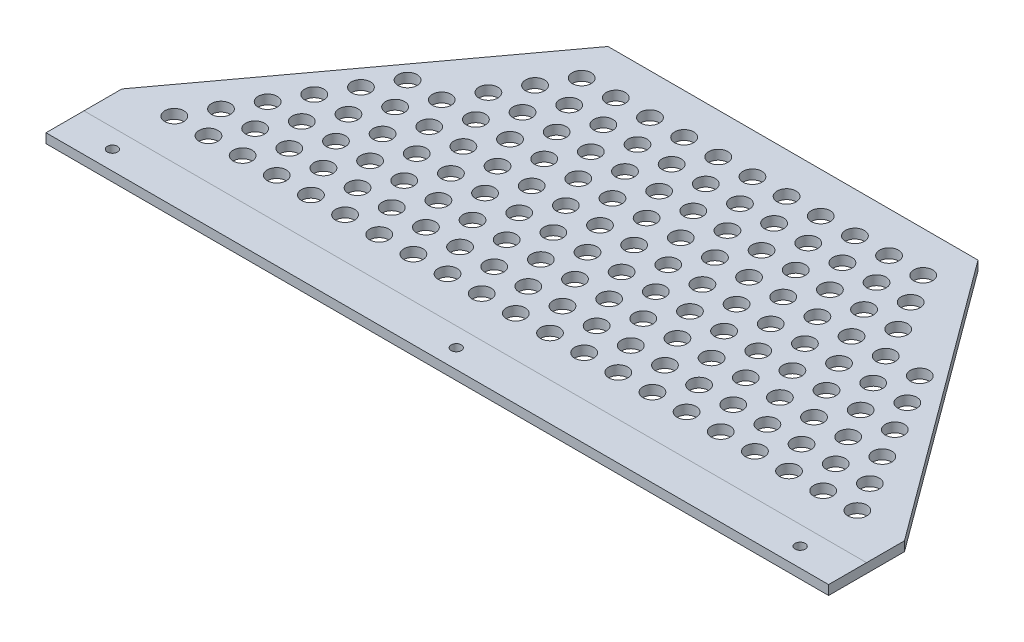
from build123d import *

# Parameters (mm, degrees)
BASE_FLANGE1_DEPTH      = 6.35
SKETCH6_R               = 3.3782
CUT_EXTRUDE1_DEPTH      = 355.055210428
FILL_START              = -6.35
FILL_PATTERN1_OUTLINE_R = 6.35
FILL_PATTERN1_DEPTH     = 6.35


# Read off the part's stored shape, not the designer's step: Fill Pattern1
# Sheet-metal steps are written as plain solids
with BuildPart() as part:
    # Sketch1 → Base-Flange1 (new body)
    with BuildSketch(Plane(origin=(0, 0, 0), x_dir=(1, 0, 0), z_dir=(0, 1, 0))):
        Polygon((-123.825, 0), (123.825, 0), (261.9375, -187.325), (261.9375, -238.125), (-261.9375, -238.125), (-261.9375, -187.325), align=None)
    extrude(amount=-BASE_FLANGE1_DEPTH)

    # Sketch6 → Cut-Extrude1 (cut, through all)
    with BuildSketch(Plane(origin=(0, 0, 0), x_dir=(1, 0, 0), z_dir=(0, 1, 0))):
        with Locations(Location((-230.1875, -225.425, 0), (0, 0, 270))):
            Circle(SKETCH6_R)
        with Locations(Location((0, -225.425, 0), (0, 0, 270))):
            Circle(SKETCH6_R)
        with Locations(Location((230.1875, -225.425, 0), (0, 0, 270))):
            Circle(SKETCH6_R)
    extrude(amount=-CUT_EXTRUDE1_DEPTH, mode=Mode.SUBTRACT)

    # Fill Pattern1 outline → Fill Pattern1 (cut)
    with BuildSketch(Plane(origin=(0, 0, 0), x_dir=(1, 0, 0), z_dir=(0, 1, 0)).offset(FILL_START)):
        with Locations((-228.6, -185.551857922)):
            Circle(FILL_PATTERN1_OUTLINE_R)
        with Locations((68.58, -27.173132078)):
            Circle(FILL_PATTERN1_OUTLINE_R)
        with Locations((45.72, -27.173132078)):
            Circle(FILL_PATTERN1_OUTLINE_R)
        with Locations((22.86, -27.173132078)):
            Circle(FILL_PATTERN1_OUTLINE_R)
        with Locations((0, -27.173132078)):
            Circle(FILL_PATTERN1_OUTLINE_R)
        with Locations((-22.86, -27.173132078)):
            Circle(FILL_PATTERN1_OUTLINE_R)
        with Locations((-45.72, -27.173132078)):
            Circle(FILL_PATTERN1_OUTLINE_R)
        with Locations((-68.58, -27.173132078)):
            Circle(FILL_PATTERN1_OUTLINE_R)
        with Locations((-91.44, -27.173132078)):
            Circle(FILL_PATTERN1_OUTLINE_R)
        with Locations((-11.43, -46.970472808)):
            Circle(FILL_PATTERN1_OUTLINE_R)
        with Locations((11.43, -46.970472808)):
            Circle(FILL_PATTERN1_OUTLINE_R)
        with Locations((34.29, -46.970472808)):
            Circle(FILL_PATTERN1_OUTLINE_R)
        with Locations((57.15, -46.970472808)):
            Circle(FILL_PATTERN1_OUTLINE_R)
        with Locations((-114.3, -27.173132078)):
            Circle(FILL_PATTERN1_OUTLINE_R)
        with Locations((125.73, -46.970472808)):
            Circle(FILL_PATTERN1_OUTLINE_R)
        with Locations((102.87, -46.970472808)):
            Circle(FILL_PATTERN1_OUTLINE_R)
        with Locations((80.01, -46.970472808)):
            Circle(FILL_PATTERN1_OUTLINE_R)
        with Locations((91.44, -27.173132078)):
            Circle(FILL_PATTERN1_OUTLINE_R)
        with Locations((114.3, -27.173132078)):
            Circle(FILL_PATTERN1_OUTLINE_R)
        with Locations((57.15, -165.754517192)):
            Circle(FILL_PATTERN1_OUTLINE_R)
        with Locations((80.01, -165.754517192)):
            Circle(FILL_PATTERN1_OUTLINE_R)
        with Locations((102.87, -165.754517192)):
            Circle(FILL_PATTERN1_OUTLINE_R)
        with Locations((125.73, -165.754517192)):
            Circle(FILL_PATTERN1_OUTLINE_R)
        with Locations((148.59, -165.754517192)):
            Circle(FILL_PATTERN1_OUTLINE_R)
        with Locations((171.45, -165.754517192)):
            Circle(FILL_PATTERN1_OUTLINE_R)
        with Locations((194.31, -165.754517192)):
            Circle(FILL_PATTERN1_OUTLINE_R)
        with Locations((217.17, -165.754517192)):
            Circle(FILL_PATTERN1_OUTLINE_R)
        with Locations((-205.74, -145.957176461)):
            Circle(FILL_PATTERN1_OUTLINE_R)
        with Locations((-182.88, -145.957176461)):
            Circle(FILL_PATTERN1_OUTLINE_R)
        with Locations((-160.02, -145.957176461)):
            Circle(FILL_PATTERN1_OUTLINE_R)
        with Locations((-137.16, -145.957176461)):
            Circle(FILL_PATTERN1_OUTLINE_R)
        with Locations((-114.3, -145.957176461)):
            Circle(FILL_PATTERN1_OUTLINE_R)
        with Locations((-91.44, -145.957176461)):
            Circle(FILL_PATTERN1_OUTLINE_R)
        with Locations((-68.58, -145.957176461)):
            Circle(FILL_PATTERN1_OUTLINE_R)
        with Locations((-45.72, -145.957176461)):
            Circle(FILL_PATTERN1_OUTLINE_R)
        with Locations((-194.31, -126.159835731)):
            Circle(FILL_PATTERN1_OUTLINE_R)
        with Locations((205.74, -145.957176461)):
            Circle(FILL_PATTERN1_OUTLINE_R)
        with Locations((182.88, -145.957176461)):
            Circle(FILL_PATTERN1_OUTLINE_R)
        with Locations((160.02, -145.957176461)):
            Circle(FILL_PATTERN1_OUTLINE_R)
        with Locations((-171.45, -126.159835731)):
            Circle(FILL_PATTERN1_OUTLINE_R)
        with Locations((-148.59, -126.159835731)):
            Circle(FILL_PATTERN1_OUTLINE_R)
        with Locations((-125.73, -126.159835731)):
            Circle(FILL_PATTERN1_OUTLINE_R)
        with Locations((-102.87, -126.159835731)):
            Circle(FILL_PATTERN1_OUTLINE_R)
        with Locations((137.16, -145.957176461)):
            Circle(FILL_PATTERN1_OUTLINE_R)
        with Locations((114.3, -145.957176461)):
            Circle(FILL_PATTERN1_OUTLINE_R)
        with Locations((91.44, -145.957176461)):
            Circle(FILL_PATTERN1_OUTLINE_R)
        with Locations((68.58, -145.957176461)):
            Circle(FILL_PATTERN1_OUTLINE_R)
        with Locations((45.72, -145.957176461)):
            Circle(FILL_PATTERN1_OUTLINE_R)
        with Locations((22.86, -145.957176461)):
            Circle(FILL_PATTERN1_OUTLINE_R)
        with Locations((0, -145.957176461)):
            Circle(FILL_PATTERN1_OUTLINE_R)
        with Locations((-22.86, -145.957176461)):
            Circle(FILL_PATTERN1_OUTLINE_R)
        with Locations((-205.74, -185.551857922)):
            Circle(FILL_PATTERN1_OUTLINE_R)
        with Locations((-182.88, -185.551857922)):
            Circle(FILL_PATTERN1_OUTLINE_R)
        with Locations((-160.02, -185.551857922)):
            Circle(FILL_PATTERN1_OUTLINE_R)
        with Locations((-137.16, -185.551857922)):
            Circle(FILL_PATTERN1_OUTLINE_R)
        with Locations((-114.3, -185.551857922)):
            Circle(FILL_PATTERN1_OUTLINE_R)
        with Locations((-91.44, -185.551857922)):
            Circle(FILL_PATTERN1_OUTLINE_R)
        with Locations((-68.58, -185.551857922)):
            Circle(FILL_PATTERN1_OUTLINE_R)
        with Locations((-45.72, -185.551857922)):
            Circle(FILL_PATTERN1_OUTLINE_R)
        with Locations((-22.86, -185.551857922)):
            Circle(FILL_PATTERN1_OUTLINE_R)
        with Locations((0, -185.551857922)):
            Circle(FILL_PATTERN1_OUTLINE_R)
        with Locations((22.86, -185.551857922)):
            Circle(FILL_PATTERN1_OUTLINE_R)
        with Locations((45.72, -185.551857922)):
            Circle(FILL_PATTERN1_OUTLINE_R)
        with Locations((68.58, -185.551857922)):
            Circle(FILL_PATTERN1_OUTLINE_R)
        with Locations((91.44, -185.551857922)):
            Circle(FILL_PATTERN1_OUTLINE_R)
        with Locations((114.3, -185.551857922)):
            Circle(FILL_PATTERN1_OUTLINE_R)
        with Locations((137.16, -185.551857922)):
            Circle(FILL_PATTERN1_OUTLINE_R)
        with Locations((34.29, -165.754517192)):
            Circle(FILL_PATTERN1_OUTLINE_R)
        with Locations((11.43, -165.754517192)):
            Circle(FILL_PATTERN1_OUTLINE_R)
        with Locations((-11.43, -165.754517192)):
            Circle(FILL_PATTERN1_OUTLINE_R)
        with Locations((-34.29, -165.754517192)):
            Circle(FILL_PATTERN1_OUTLINE_R)
        with Locations((-57.15, -165.754517192)):
            Circle(FILL_PATTERN1_OUTLINE_R)
        with Locations((-80.01, -165.754517192)):
            Circle(FILL_PATTERN1_OUTLINE_R)
        with Locations((-102.87, -165.754517192)):
            Circle(FILL_PATTERN1_OUTLINE_R)
        with Locations((-125.73, -165.754517192)):
            Circle(FILL_PATTERN1_OUTLINE_R)
        with Locations((-148.59, -165.754517192)):
            Circle(FILL_PATTERN1_OUTLINE_R)
        with Locations((-171.45, -165.754517192)):
            Circle(FILL_PATTERN1_OUTLINE_R)
        with Locations((-194.31, -165.754517192)):
            Circle(FILL_PATTERN1_OUTLINE_R)
        with Locations((-217.17, -165.754517192)):
            Circle(FILL_PATTERN1_OUTLINE_R)
        with Locations((228.6, -185.551857922)):
            Circle(FILL_PATTERN1_OUTLINE_R)
        with Locations((205.74, -185.551857922)):
            Circle(FILL_PATTERN1_OUTLINE_R)
        with Locations((182.88, -185.551857922)):
            Circle(FILL_PATTERN1_OUTLINE_R)
        with Locations((160.02, -185.551857922)):
            Circle(FILL_PATTERN1_OUTLINE_R)
        with Locations((57.15, -86.565154269)):
            Circle(FILL_PATTERN1_OUTLINE_R)
        with Locations((80.01, -86.565154269)):
            Circle(FILL_PATTERN1_OUTLINE_R)
        with Locations((102.87, -86.565154269)):
            Circle(FILL_PATTERN1_OUTLINE_R)
        with Locations((125.73, -86.565154269)):
            Circle(FILL_PATTERN1_OUTLINE_R)
        with Locations((148.59, -86.565154269)):
            Circle(FILL_PATTERN1_OUTLINE_R)
        with Locations((171.45, -86.565154269)):
            Circle(FILL_PATTERN1_OUTLINE_R)
        with Locations((-137.16, -66.767813539)):
            Circle(FILL_PATTERN1_OUTLINE_R)
        with Locations((-114.3, -66.767813539)):
            Circle(FILL_PATTERN1_OUTLINE_R)
        with Locations((34.29, -86.565154269)):
            Circle(FILL_PATTERN1_OUTLINE_R)
        with Locations((11.43, -86.565154269)):
            Circle(FILL_PATTERN1_OUTLINE_R)
        with Locations((-11.43, -86.565154269)):
            Circle(FILL_PATTERN1_OUTLINE_R)
        with Locations((-34.29, -86.565154269)):
            Circle(FILL_PATTERN1_OUTLINE_R)
        with Locations((-57.15, -86.565154269)):
            Circle(FILL_PATTERN1_OUTLINE_R)
        with Locations((-80.01, -86.565154269)):
            Circle(FILL_PATTERN1_OUTLINE_R)
        with Locations((-102.87, -86.565154269)):
            Circle(FILL_PATTERN1_OUTLINE_R)
        with Locations((-125.73, -86.565154269)):
            Circle(FILL_PATTERN1_OUTLINE_R)
        with Locations((-125.73, -46.970472808)):
            Circle(FILL_PATTERN1_OUTLINE_R)
        with Locations((137.16, -66.767813539)):
            Circle(FILL_PATTERN1_OUTLINE_R)
        with Locations((114.3, -66.767813539)):
            Circle(FILL_PATTERN1_OUTLINE_R)
        with Locations((91.44, -66.767813539)):
            Circle(FILL_PATTERN1_OUTLINE_R)
        with Locations((-102.87, -46.970472808)):
            Circle(FILL_PATTERN1_OUTLINE_R)
        with Locations((-80.01, -46.970472808)):
            Circle(FILL_PATTERN1_OUTLINE_R)
        with Locations((-57.15, -46.970472808)):
            Circle(FILL_PATTERN1_OUTLINE_R)
        with Locations((-34.29, -46.970472808)):
            Circle(FILL_PATTERN1_OUTLINE_R)
        with Locations((68.58, -66.767813539)):
            Circle(FILL_PATTERN1_OUTLINE_R)
        with Locations((45.72, -66.767813539)):
            Circle(FILL_PATTERN1_OUTLINE_R)
        with Locations((22.86, -66.767813539)):
            Circle(FILL_PATTERN1_OUTLINE_R)
        with Locations((0, -66.767813539)):
            Circle(FILL_PATTERN1_OUTLINE_R)
        with Locations((-22.86, -66.767813539)):
            Circle(FILL_PATTERN1_OUTLINE_R)
        with Locations((-45.72, -66.767813539)):
            Circle(FILL_PATTERN1_OUTLINE_R)
        with Locations((-68.58, -66.767813539)):
            Circle(FILL_PATTERN1_OUTLINE_R)
        with Locations((-91.44, -66.767813539)):
            Circle(FILL_PATTERN1_OUTLINE_R)
        with Locations((102.87, -126.159835731)):
            Circle(FILL_PATTERN1_OUTLINE_R)
        with Locations((125.73, -126.159835731)):
            Circle(FILL_PATTERN1_OUTLINE_R)
        with Locations((148.59, -126.159835731)):
            Circle(FILL_PATTERN1_OUTLINE_R)
        with Locations((171.45, -126.159835731)):
            Circle(FILL_PATTERN1_OUTLINE_R)
        with Locations((-137.16, -106.362495)):
            Circle(FILL_PATTERN1_OUTLINE_R)
        with Locations((-160.02, -106.362495)):
            Circle(FILL_PATTERN1_OUTLINE_R)
        with Locations((-182.88, -106.362495)):
            Circle(FILL_PATTERN1_OUTLINE_R)
        with Locations((194.31, -126.159835731)):
            Circle(FILL_PATTERN1_OUTLINE_R)
        with Locations((80.01, -126.159835731)):
            Circle(FILL_PATTERN1_OUTLINE_R)
        with Locations((57.15, -126.159835731)):
            Circle(FILL_PATTERN1_OUTLINE_R)
        with Locations((34.29, -126.159835731)):
            Circle(FILL_PATTERN1_OUTLINE_R)
        with Locations((11.43, -126.159835731)):
            Circle(FILL_PATTERN1_OUTLINE_R)
        with Locations((-11.43, -126.159835731)):
            Circle(FILL_PATTERN1_OUTLINE_R)
        with Locations((-34.29, -126.159835731)):
            Circle(FILL_PATTERN1_OUTLINE_R)
        with Locations((-57.15, -126.159835731)):
            Circle(FILL_PATTERN1_OUTLINE_R)
        with Locations((-80.01, -126.159835731)):
            Circle(FILL_PATTERN1_OUTLINE_R)
        with Locations((68.58, -106.362495)):
            Circle(FILL_PATTERN1_OUTLINE_R)
        with Locations((91.44, -106.362495)):
            Circle(FILL_PATTERN1_OUTLINE_R)
        with Locations((114.3, -106.362495)):
            Circle(FILL_PATTERN1_OUTLINE_R)
        with Locations((137.16, -106.362495)):
            Circle(FILL_PATTERN1_OUTLINE_R)
        with Locations((160.02, -106.362495)):
            Circle(FILL_PATTERN1_OUTLINE_R)
        with Locations((182.88, -106.362495)):
            Circle(FILL_PATTERN1_OUTLINE_R)
        with Locations((-171.45, -86.565154269)):
            Circle(FILL_PATTERN1_OUTLINE_R)
        with Locations((-148.59, -86.565154269)):
            Circle(FILL_PATTERN1_OUTLINE_R)
        with Locations((45.72, -106.362495)):
            Circle(FILL_PATTERN1_OUTLINE_R)
        with Locations((22.86, -106.362495)):
            Circle(FILL_PATTERN1_OUTLINE_R)
        with Locations((0, -106.362495)):
            Circle(FILL_PATTERN1_OUTLINE_R)
        with Locations((-22.86, -106.362495)):
            Circle(FILL_PATTERN1_OUTLINE_R)
        with Locations((-45.72, -106.362495)):
            Circle(FILL_PATTERN1_OUTLINE_R)
        with Locations((-68.58, -106.362495)):
            Circle(FILL_PATTERN1_OUTLINE_R)
        with Locations((-91.44, -106.362495)):
            Circle(FILL_PATTERN1_OUTLINE_R)
        with Locations((-114.3, -106.362495)):
            Circle(FILL_PATTERN1_OUTLINE_R)
    extrude(amount=FILL_PATTERN1_DEPTH, mode=Mode.SUBTRACT)


solid = part.part
